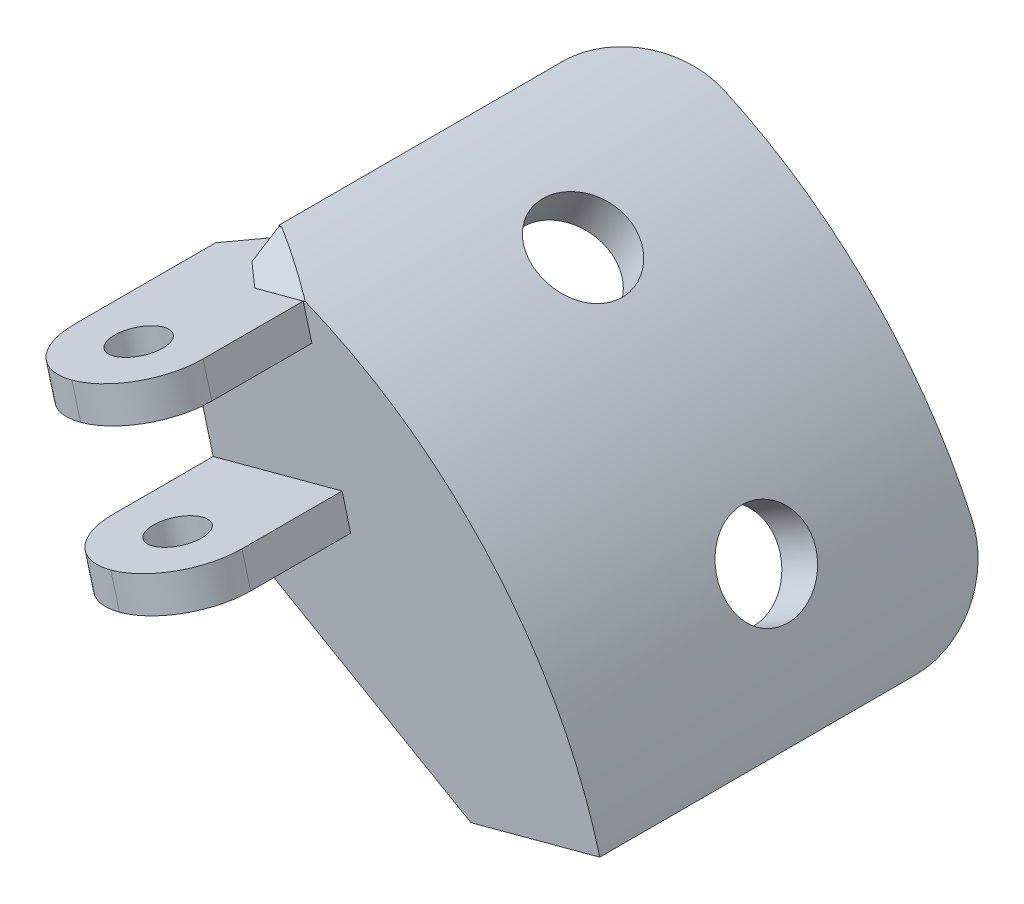
from build123d import *

# Parameters (mm, degrees)
BOSS_EXTRUDE1_DEPTH = 27.94
SKETCH3_R           = 3.4925
CUT_EXTRUDE1_DEPTH  = 5.08
CIRPATTERN1_COUNT   = 2
CIRPATTERN1_ANGLE   = 30
FILLET2_R           = 6.35
BOSS_EXTRUDE2_DEPTH = 2.54
BOSS_EXTRUDE3_DEPTH = 12.7
FILLET3_R           = 5.08
SKETCH10_R          = 1.905
CUT_EXTRUDE2_DEPTH  = 25.4
CHAMFER2_SIZE       = 2.54
CHAMFER3_SIZE       = 15.24
BOSS_EXTRUDE4_DEPTH = 27.94
CHAMFER4_SIZE       = 12.7
CHAMFER5_SIZE       = 5.08


# Some blends are built 0.0001 mm under size
with BuildPart() as part:
    # Sketch1 → Boss-Extrude1 (new body)
    with BuildSketch(Plane.XY):
        with BuildLine():
            Line((9.358125546, 34.925), (9.861005618, 36.801773982))
            ThreePointArc((9.861005618, 36.801773982), (26.940768363, 26.940768363), (36.801773982, 9.861005618))
            Line((36.801773982, 9.861005618), (34.925, 9.358125546))
            Line((34.925, 9.358125546), (25.566874454, 25.566874454))
            Line((25.566874454, 25.566874454), (9.358125546, 34.925))
        make_face()
    extrude(amount=BOSS_EXTRUDE1_DEPTH)

    # Sketch3 → Cut-Extrude1 (cut)
    with BuildSketch(Plane(origin=(17.4625, 30.245937227, 0), x_dir=(-0.8660254037844386, 0.4999999999999999, 0), z_dir=(-0.49999999999999994, -0.8660254037844387, 0))):
        with Locations(Location((0, -13.97, 0), (0, 0, 180))):
            Circle(SKETCH3_R)
    cut_extrude1 = extrude(amount=-CUT_EXTRUDE1_DEPTH, mode=Mode.SUBTRACT)

    # CirPattern1: Cut-Extrude1 ×2 about axis
    cirpattern1_axis = Axis((0, 0, 27.94), (0, 0, -1))
    for i in range(1, CIRPATTERN1_COUNT):
        add(cut_extrude1.rotate(cirpattern1_axis, i * CIRPATTERN1_ANGLE / (CIRPATTERN1_COUNT - 1)), mode=Mode.SUBTRACT)

    # Fillet2
    fillet2_edges = [part.edges().sort_by_distance(p)[0] for p in [
        (9.609565582, 35.863386991, 0),
        (35.863386991, 9.609565582, 0),
        (25.566874454, 25.566874454, 13.97),
    ]]
    fillet(fillet2_edges, radius=FILLET2_R)

    # Sketch7 → Boss-Extrude2 (add)
    with BuildSketch(Plane.XY.offset(27.94)):
        with BuildLine():
            Line((12.267257994, 3.287001873), (36.801773982, 9.861005618))
            ThreePointArc((36.801773982, 9.861005618), (28.576381723, 25.199214424), (14.387753745, 35.278924901))
            Line((14.387753745, 35.278924901), (4.411323518, 32.605748478))
            Line((4.411323518, 32.605748478), (12.267257994, 3.287001873))
        make_face()
    extrude(amount=BOSS_EXTRUDE2_DEPTH)

    # Sketch8 → Boss-Extrude3 (add)
    with BuildSketch(Plane.XY.offset(30.48)):
        Polygon((4.411323518, 32.605748478), (14.225129913, 35.235349976), (14.882530288, 32.781898378), (5.068723892, 30.152296879), align=None)
        Polygon((7.369625203, 21.565216284), (17.183431598, 24.194817782), (17.840831973, 21.741366183), (8.027025578, 19.111764685), align=None)
    extrude(amount=BOSS_EXTRUDE3_DEPTH)

    # Fillet3
    fillet3_edges = [part.edges().sort_by_distance(p)[0] for p in [
        (14.5538301, 34.008624177, 43.18),
        (17.512131786, 22.968091983, 43.18),
        (7.698325391, 20.338490484, 43.18),
        (4.740023705, 31.379022679, 43.18),
    ]]
    fillet(fillet3_edges, radius=FILLET3_R - 0.0001)  # a hair under: the kernel refuses the full size

    # Sketch10 → Cut-Extrude2 (cut)
    with BuildSketch(Plane(origin=(-4.240232416, 15.824762812, 0), x_dir=(0.9659258262890666, 0.2588190451025272, 0), z_dir=(0.2588190451025272, -0.9659258262890666, 0))):
        with Locations((17.78, 38.1)):
            Circle(SKETCH10_R)
    extrude(amount=-CUT_EXTRUDE2_DEPTH, mode=Mode.SUBTRACT)

    # Chamfer2
    # the kernel refuses this chamfer: 2.54 mm, written as the material it adds along each edge
    with BuildSketch(Plane(origin=(20.697253484, 36.96955026, 27.94), x_dir=(0.00711645652860803, -0.026558977334619874, 0.9996219169112968), z_dir=(-0.9659258262890671, -0.25881904510252557, 0))) as chamfer2_piece_1_section:
        Polygon((CHAMFER2_SIZE * 0.999621916911, CHAMFER2_SIZE * 0.0274958766106), (-CHAMFER2_SIZE * 0.0274958766106, CHAMFER2_SIZE * 0.999621916911), (0, 0), align=None)
    chamfer2_piece_1 = extrude(amount=17.054101493, mode=Mode.PRIVATE)
    chamfer2_piece_1 = chamfer2_piece_1 & Plane(origin=(0, 0, 29.188992539), x_dir=(0.25881904510252113, 0.9659258262890682, 0), z_dir=(0, 0, -1)) * Cylinder(38.1, 45, mode=Mode.PRIVATE)
    chamfer2_piece_1 = split(chamfer2_piece_1, bisect_by=Plane(origin=(9.778458112, 36.493702493, 29.188992539), z_dir=(0.9659258262890693, -0.25881904510251724, 0)), keep=Keep.TOP, mode=Mode.PRIVATE)
    chamfer2_piece_1 = split(chamfer2_piece_1, bisect_by=Plane(origin=(12.882809536, 32.89002275, 29.188992539), z_dir=(0.4999999999999998, 0.8660254037844388, 0)), keep=Keep.TOP, mode=Mode.PRIVATE)
    add(chamfer2_piece_1)

    # Chamfer3
    chamfer3_edges = [part.edges().sort_by_distance(p)[0] for p in [
        (12.267257994, 3.287001873, 29.21),
    ]]
    chamfer(chamfer3_edges, length=CHAMFER3_SIZE)

    # Sketch11 → Boss-Extrude4 (add)
    with BuildSketch(Plane(origin=(0, 0, 27.94), x_dir=(-1, 0, 0), z_dir=(0, 0, -1))):
        with BuildLine():
            Line((-26.41761314, 24.093351826), (-19.258764216, 11.693861766))
            Line((-19.258764216, 11.693861766), (-16.509133559, 13.281361766))
            Line((-16.509133559, 13.281361766), (-24.093351826, 26.41761314))
            ThreePointArc((-24.093351826, 26.41761314), (-25.408479887, 25.408479887), (-26.41761314, 24.093351826))
        make_face()
    extrude(amount=BOSS_EXTRUDE4_DEPTH)

    # Chamfer4
    chamfer4_edges = [part.edges().sort_by_distance(p)[0] for p in [
        (17.883948888, 12.487611766, 0),
    ]]
    chamfer(chamfer4_edges, length=CHAMFER4_SIZE)

    # Chamfer5
    # the kernel refuses this chamfer: 5.08 mm, written as the material it adds along each edge
    with BuildSketch(Plane(origin=(35.40723724, 19.885538351, 27.94), x_dir=(-0.49981095845564816, -0.8656979742248805, 0.027495876610586608), z_dir=(-0.8660254037844388, 0.4999999999999998, 0))) as chamfer5_piece_1_section:
        Polygon((CHAMFER5_SIZE * 0.999621916911, -CHAMFER5_SIZE * 0.0274958766106), (-CHAMFER5_SIZE * 0.0274958766106, -CHAMFER5_SIZE * 0.999621916911), (0, 0), align=None)
    chamfer5_piece_1 = extrude(amount=41.78557159, mode=Mode.PRIVATE)
    chamfer5_piece_1 = split(chamfer5_piece_1, bisect_by=Plane(origin=(8.735724363, 16.466864811, 26.882684671), z_dir=(0.9659258262890666, 0.25881904510252707, 0)), keep=Keep.TOP, mode=Mode.PRIVATE)
    chamfer5_piece_1 = split(chamfer5_piece_1, bisect_by=Plane(origin=(27.739257301, 21.804196991, 26.882684671), z_dir=(-0.8660254037844388, -0.4999999999999997, 0)), keep=Keep.TOP, mode=Mode.PRIVATE)
    chamfer5_piece_1 = split(chamfer5_piece_1, bisect_by=Plane(origin=(22.621869959, 37.485249691, 26.882684671), z_dir=(0.25881904510252557, -0.9659258262890671, 0)), keep=Keep.TOP, mode=Mode.PRIVATE)
    add(chamfer5_piece_1)
    with BuildSketch(Plane(origin=(41.457074789, -1.955759868, 27.94), x_dir=(-0.8656979742248805, -0.49981095845564805, 0.027495876610586608), z_dir=(-0.4999999999999997, 0.8660254037844388, 0))) as chamfer5_piece_2_section:
        Polygon((CHAMFER5_SIZE * 0.999621916911, -CHAMFER5_SIZE * 0.0274958766106), (-CHAMFER5_SIZE * 0.0274958766106, -CHAMFER5_SIZE * 0.999621916911), (0, 0), align=None)
    chamfer5_piece_2 = extrude(amount=43.143072877, mode=Mode.PRIVATE)
    chamfer5_piece_2 = split(chamfer5_piece_2, bisect_by=Plane(origin=(31.353292894, 8.401089511, 26.207782455), z_dir=(-0.2588190451025267, 0.9659258262890668, 0)), keep=Keep.TOP, mode=Mode.PRIVATE)
    chamfer5_piece_2 = split(chamfer5_piece_2, bisect_by=Plane(origin=(32.711409072, 21.441975469, 26.207782455), z_dir=(-0.50000000000019, -0.866025403784329, 0)), keep=Keep.TOP, mode=Mode.PRIVATE)
    add(chamfer5_piece_2)


solid = part.part
